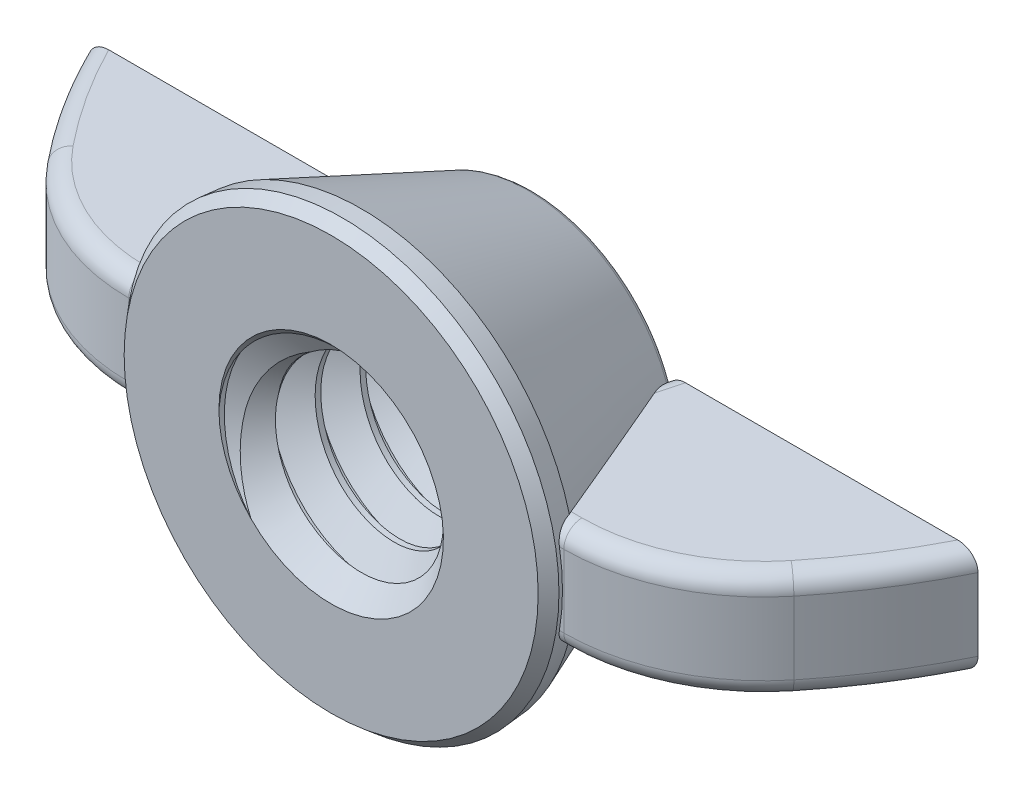
from build123d import *

# Parameters (mm, degrees)
EXTRUDE2_DEPTH     = 1.537890625
SKETCH3_R          = 6.1515625
EXTRUDE1_DEPTH     = 0.85725
EXTRUDE1_DRAFT     = -5
SKETCH15_R         = 6.076562843
EXTRUDE3_DEPTH     = 4.85775
EXTRUDE3_TAPER     = 21.960198558
FILLET3_R          = 0.254
SKETCH4_R          = 3.175
CUT_EXTRUDE1_DEPTH = 23.225885864
SWEEP1_PITCH       = 1.27
SKETCH7_R          = 6.1515625
CUT_EXTRUDE2_DEPTH = 23.225885892
SKETCH8_R          = 6.076562843
CUT_EXTRUDE3_DEPTH = 19.579558086
SKETCH11_R         = 3.1242
CUT_EXTRUDE5_DEPTH = 19.579558053
CUT_EXTRUDE5_TAPER = 45
CHAMFER1_SIZE      = 0.32146875
CHAMFER1_SIZE2     = 0.296735699
FILLET4_R          = 0.512630208
SKETCH16_R         = 15.32264572
CUT_EXTRUDE6_DEPTH = 19.57030039


with BuildPart() as part:
    # Sketch13 → Extrude2 (new, symmetric)
    with BuildSketch(Plane(origin=(0, 0, 0), x_dir=(1, 0, 0), z_dir=(0, 1, 0))):
        with BuildLine():
            Line((3.773545526, 0.428625), (6.1515625, 0.428625))
            ThreePointArc((6.1515625, 0.428625), (8.590910612, 0.981496101), (10.553521716, 2.53205836))
            ThreePointArc((10.553521716, 2.53205836), (13.326559198, 7.495965423), (14.2875, 13.10013378))
            ThreePointArc((14.2875, 13.10013378), (14.187492334, 13.501242622), (13.91088161, 13.808449953))
            ThreePointArc((13.91088161, 13.808449953), (10.685615281, 15.346823078), (7.151500977, 15.875))
            ThreePointArc((7.151500977, 15.875), (6.631385147, 15.698444466), (6.326229714, 15.241747088))
            Line((6.326229714, 15.241747088), (3.773545526, 5.715))
            Line((3.773545526, 5.715), (3.773545526, 0.428625))
        make_face()
    extrude(amount=EXTRUDE2_DEPTH, both=True)

    # Fillet4
    fillet4_edges = [part.edges().sort_by_distance(p)[0] for p in [
        (8.590910612, 1.537890625, -0.981496101),
        (4.962554013, -1.537890625, -0.428625),
        (13.326559198, 1.537890625, -7.495965423),
        (14.187492334, 1.537890625, -13.501242622),
        (10.685615281, 1.537890625, -15.346823078),
        (6.631385147, 1.537890625, -15.698444466),
        (5.04988762, 1.537890625, -10.478373544),
        (4.962554013, 1.537890625, -0.428625),
        (5.04988762, -1.537890625, -10.478373544),
        (6.631385147, -1.537890625, -15.698444466),
        (10.685615281, -1.537890625, -15.346823078),
        (14.187492334, -1.537890625, -13.501242622),
        (13.326559198, -1.537890625, -7.495965423),
        (8.590910612, -1.537890625, -0.981496101),
    ]]
    fillet(fillet4_edges, radius=FILLET4_R)


with BuildPart() as body_2:
    # Sketch3 → Extrude1 (with draft: the straight prism first)
    with BuildSketch(Plane.XY):
        Circle(SKETCH3_R)
    extrude(amount=-EXTRUDE1_DEPTH)
    # Extrude1: the draft: its side faces are tilted about the plane it starts from
    extrude1_sides = [body_2.faces().sort_by_distance(p)[0] for p in [
        (-6.1515625, 0, -0.428625),
    ]]
    draft(extrude1_sides, Plane.XY, EXTRUDE1_DRAFT)

    # Sketch15 → Extrude3 (add)
    with BuildSketch(Plane(origin=(0, 0, -0.85725), x_dir=(-1, 0, 0), z_dir=(0, 0, -1))):
        Circle(SKETCH15_R)
    extrude(amount=EXTRUDE3_DEPTH, taper=EXTRUDE3_TAPER)

    # Fillet3
    fillet3_edges = [body_2.edges().sort_by_distance(p)[0] for p in [
        (4.117828705, 0, -5.715),
    ]]
    fillet(fillet3_edges, radius=FILLET3_R)

    # Sketch4 → Cut-Extrude1 (cut, through all)
    with BuildSketch(Plane.XY):
        Circle(SKETCH4_R)
    extrude(amount=-CUT_EXTRUDE1_DEPTH, mode=Mode.SUBTRACT)

    # Sweep1: the profile of Sketch6 profile screwed along a right-hand helix of 7 turns, 6 arcs to a turn; built about Z, then put on its axis
    sweep1_z = Axis((0, 0, 0), (0, 0, 1))
    sweep1_corners = [(3.1753, 0, -1.111423205), (2.350110803, 0, -0.635), (2.350110803, 0, -0.47625), (3.1753, 0, 0.000173205)]
    with BuildLine(mode=Mode.PRIVATE) as sweep1_profile:
        Line(sweep1_corners[0], sweep1_corners[1])
        Line(sweep1_corners[1], sweep1_corners[2])
        Line(sweep1_corners[2], sweep1_corners[3])
        Line(sweep1_corners[3], sweep1_corners[0])
    sweep1_cap = Face(sweep1_profile.wire())
    sweep1_turn_angles = [0, 30, 60, 90, 120, 150, 180, 210, 240, 270, 300, 330, 360]
    sweep1_turn_weights = [1, 0.8660254037844387, 1, 0.8660254037844387, 1, 0.8660254037844387, 1, 0.8660254037844387, 1, 0.8660254037844387, 1, 0.8660254037844387, 1]
    sweep1_turn_rails = [Edge.make_bspline([Vector(p[0], p[1], 0).rotate(sweep1_z, sweep1_turn_angles[k]) / sweep1_turn_weights[k] + Vector(0, 0, p[2] + SWEEP1_PITCH * sweep1_turn_angles[k] / 360) for k in range(13)], [0, 0, 0, 1, 1, 2, 2, 3, 3, 4, 4, 5, 5, 6, 6, 6], 2, sweep1_turn_weights) for p in sweep1_corners]
    sweep1_turn_sides = [Face.make_surface_from_curves(sweep1_turn_rails[p[0]], sweep1_turn_rails[p[1]]) for p in [(0, 1), (1, 2), (2, 3), (3, 0)]]
    sweep1 = Plane(origin=(0, 0, 0), x_dir=(-1, 0, 0), z_dir=(0, 0, -1)) * Solid(Shell([*[p.moved(Location((0, 0, SWEEP1_PITCH * i))) for i in range(7) for p in sweep1_turn_sides], sweep1_cap, sweep1_cap.rotate(sweep1_z, 2520).moved(Location((0, 0, SWEEP1_PITCH * 2520 / 360)))]))
    add(sweep1)

    # Sketch7 → Cut-Extrude2 (cut, through all)
    with BuildSketch(Plane.XY):
        Circle(SKETCH7_R)
    extrude(amount=CUT_EXTRUDE2_DEPTH, mode=Mode.SUBTRACT)

    # Sketch8 → Cut-Extrude3 (cut, through all)
    with BuildSketch(Plane.XY.offset(-5.715)):
        Circle(SKETCH8_R)
    extrude(amount=-CUT_EXTRUDE3_DEPTH, mode=Mode.SUBTRACT)

    # Cut-Extrude4 cone 1 section (through the dimple's axis) → Cut-Extrude4 (revolve, cut)
    with BuildSketch(Plane(origin=(0, 0, 0), x_dir=(0, -1, 0), z_dir=(1, 0, 0))):
        Polygon((0, 0), (3.175, 0), (0, 3.175), align=None)
    revolve(axis=Axis((0, 0, 0), (0, 0, -1)), mode=Mode.SUBTRACT)

    # Sketch11 → Cut-Extrude5 (cut, through all)
    with BuildSketch(Plane.XY.offset(-5.715)):
        Circle(SKETCH11_R)
    extrude(amount=CUT_EXTRUDE5_DEPTH, taper=CUT_EXTRUDE5_TAPER, mode=Mode.SUBTRACT)

    # Chamfer1
    chamfer1_edges = [body_2.edges().sort_by_distance(p)[0] for p in [
        (-6.1515625, 0, 0),
    ]]
    chamfer1_side = [body_2.faces().sort_by_distance(p)[0] for p in [
        (-6.114062672, 0, -0.428625),
    ]]
    chamfer(chamfer1_edges, length=CHAMFER1_SIZE, length2=CHAMFER1_SIZE2, reference=chamfer1_side[0])


with BuildPart() as body_3:
    # Mirror6: mirrored copy
    add(part.part.mirror(Plane(origin=(0, 0, 0), x_dir=(0, 0, 1), z_dir=(1, 0, 0))))

    # Combine2: union part, body 2
    add(part.part)
    add(body_2.part)

    # Sketch16 → Cut-Extrude6 (cut, through all)
    with BuildSketch(Plane(origin=(0, 0, -5.715), x_dir=(-1, 0, 0), z_dir=(0, 0, -1))):
        Circle(SKETCH16_R)
    extrude(amount=CUT_EXTRUDE6_DEPTH, mode=Mode.SUBTRACT)


solid = body_3.part
